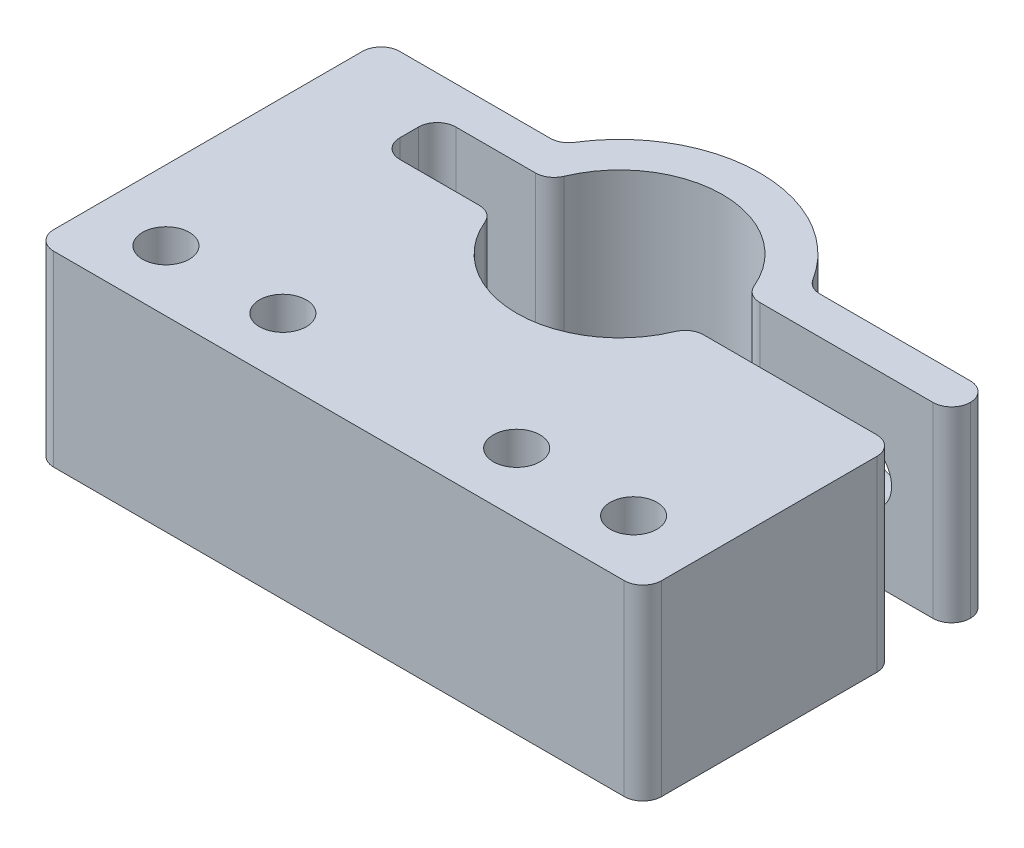
from build123d import *

# Parameters (mm, degrees)
SKETCH1_W                = 65
SKETCH1_H                = 60
SKETCH1_R                = 11
BOSS_EXTRUDE1_DEPTH      = 20
CUT_EXTRUDE1_DEPTH       = 49.541219597
CUT_EXTRUDE1_DEPTH_BACK  = 49.541219597
M6_TAPPED_HOLE2_D        = 5
LPATTERN2_COUNT          = 2
LPATTERN2_PITCH          = 12.5
MIRROR2_COPY_1_D         = 5
CUT_EXTRUDE2_DEPTH       = 49.541219597
M6_CLEARANCE_HOLE1_D     = 6.4
M6_CLEARANCE_HOLE1_DEPTH = 4
M6_TAPPED_HOLE1_D        = 5
M6_TAPPED_HOLE1_DEPTH    = 10
M6_TAPPED_HOLE1_TIP      = 1.502151548
FILLET1_R                = 2


with BuildPart() as part:
    # Sketch1 → Boss-Extrude1 (new body)
    with BuildSketch(Plane(origin=(0, 0, 0), x_dir=(1, 0, 0), z_dir=(0, 1, 0))):
        Rectangle(SKETCH1_W, SKETCH1_H)
        with Locations(Location((0, 0, 0), (0, 0, 270))):
            Circle(SKETCH1_R, mode=Mode.SUBTRACT)
    extrude(amount=BOSS_EXTRUDE1_DEPTH)

    # Sketch2 → Cut-Extrude1 (cut, two sides: drawn at the far end of the back side and taken through both)
    with BuildSketch(Plane(origin=(0, 20, 0), x_dir=(1, 0, 0), z_dir=(0, 1, 0)).offset(-CUT_EXTRUDE1_DEPTH_BACK)):
        Polygon((188.294375749, 3), (32.5, 3), (-22.5, 3), (-22.5, -3), (32.5, -3), (188.294375749, -3), (499.883127247, -3), (499.883127247, 3), align=None)
    extrude(amount=CUT_EXTRUDE1_DEPTH + CUT_EXTRUDE1_DEPTH_BACK, mode=Mode.SUBTRACT)

    # M6 Tapped Hole2 (through all)
    with Locations(Plane(origin=(0, 20, 0), x_dir=(1, 0, 0), z_dir=(0, 1, 0))):
        with Locations((12.5, -23.5)):
            m6_tapped_hole2 = Hole(M6_TAPPED_HOLE2_D / 2)

    # LPattern2: M6 Tapped Hole2 ×2
    with Locations(*[(i * LPATTERN2_PITCH, 0, 0) for i in range(1, LPATTERN2_COUNT)]):
        add(m6_tapped_hole2, mode=Mode.SUBTRACT)

    # Mirror2: M6 Tapped Hole2 across plane
    add(m6_tapped_hole2.mirror(Plane(origin=(0, 0, 0), x_dir=(0, 0, 1), z_dir=(1, 0, 0))), mode=Mode.SUBTRACT)

    # Mirror2 copy 1 (through all)
    with Locations(Plane(origin=(-12.5, 20, 0), x_dir=(-1, 0, 0), z_dir=(0, 1, 0))):
        with Locations((12.5, 23.5)):
            Hole(MIRROR2_COPY_1_D / 2)

    # Sketch6 → Cut-Extrude2 (cut, through all)
    with BuildSketch(Plane(origin=(0, 20, 0), x_dir=(1, 0, 0), z_dir=(0, 1, 0))):
        with BuildLine():
            Line((-32.5, 7), (-13.266499161, 7))
            ThreePointArc((-13.266499161, 7), (0, 15), (13.266499161, 7))
            Line((13.266499161, 7), (32.5, 7))
            Line((32.5, 7), (32.5, 30))
            Line((32.5, 30), (-32.5, 30))
            Line((-32.5, 30), (-32.5, 7))
        make_face()
    extrude(amount=-CUT_EXTRUDE2_DEPTH, mode=Mode.SUBTRACT)

    # M6 Clearance Hole1
    with Locations(Plane(origin=(0, 0, -7), x_dir=(-1, 0, 0), z_dir=(0, 0, -1))):
        with Locations((-22.883249581, 10)):
            Hole(M6_CLEARANCE_HOLE1_D / 2, depth=M6_CLEARANCE_HOLE1_DEPTH)

    # M6 Tapped Hole1
    with Locations(Plane(origin=(0, 0, 3), x_dir=(-1, 0, 0), z_dir=(0, 0, -1))):
        with Locations((-22.883249581, 10)):
            Hole(M6_TAPPED_HOLE1_D / 2, depth=M6_TAPPED_HOLE1_DEPTH)
            with Locations((0, 0, -(M6_TAPPED_HOLE1_DEPTH + M6_TAPPED_HOLE1_TIP / 2))):  # 118° drill point
                Cone(0, M6_TAPPED_HOLE1_D / 2, M6_TAPPED_HOLE1_TIP, mode=Mode.SUBTRACT)

    # Fillet1
    fillet1_edges = [part.edges().sort_by_distance(p)[0] for p in [
        (-10.583005244, 10, 3),
        (10.583005244, 10, 3),
        (10.583005244, 10, -3),
        (-10.583005244, 10, -3),
        (-22.5, 10, 3),
        (-22.5, 10, -3),
        (32.5, 10, 3),
        (32.5, 10, -3),
        (-32.5, 10, -7),
        (32.5, 10, -7),
        (13.266499161, 10, -7),
        (-13.266499161, 10, -7),
        (32.5, 10, 30),
        (-32.5, 10, 30),
    ]]
    fillet(fillet1_edges, radius=FILLET1_R - 0.0001)  # a hair under: the kernel refuses the full size


solid = part.part
